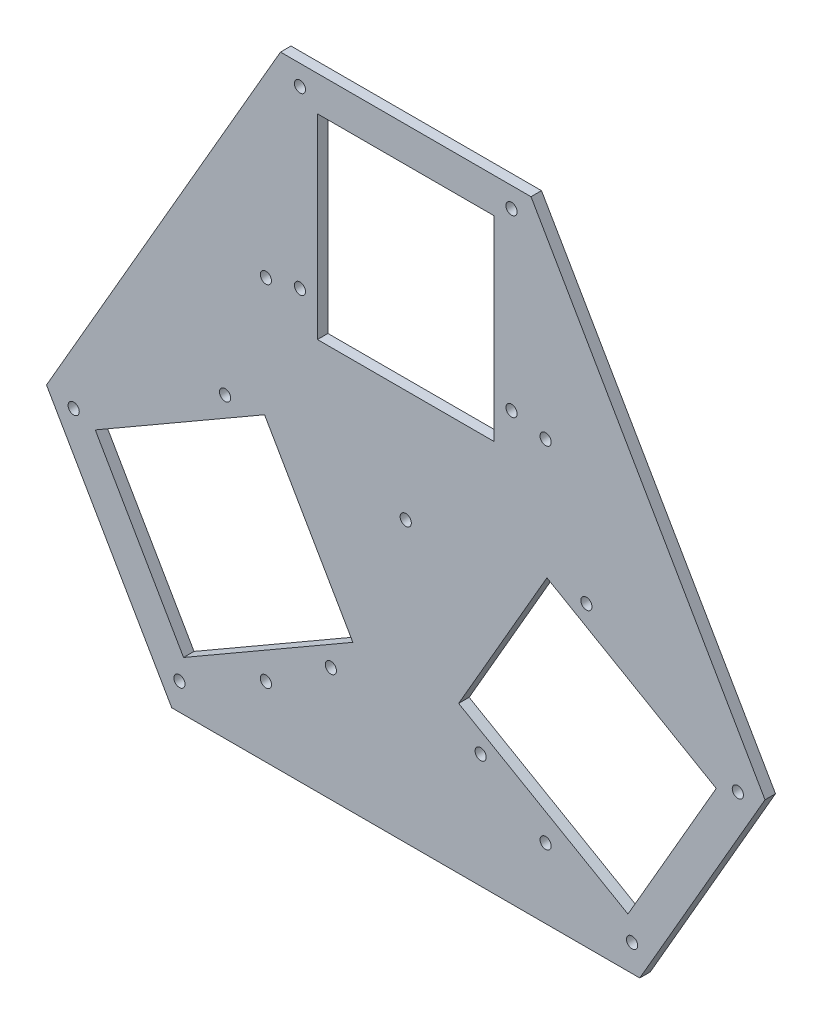
from build123d import *

# Parameters (mm, degrees)
SKETCH_1_R      = 1.6
SKETCH_1_W      = 50.5
SKETCH_1_H      = 55.910884284
EXTRUDE_1_DEPTH = 3


with BuildPart() as part:
    # ｽｹｯﾁ1 → ﾎﾞｽ - 押し出し1 (new body)
    with BuildSketch(Plane.XY):
        Polygon((35.821442181, 97.955442142), (-35.821442181, 97.955442142), (-102.742622424, -17.955442142), (-66.921180243, -80), (66.921180243, -80), (102.742622424, -17.955442142), align=None)
        with Locations((-64.718643518, -72.295017542)):
            Circle(SKETCH_1_R, mode=Mode.SUBTRACT)
        with Locations((-40, -60)):
            Circle(SKETCH_1_R, mode=Mode.SUBTRACT)
        with Locations((-21.417373328, -47.295017542)):
            Circle(SKETCH_1_R, mode=Mode.SUBTRACT)
        with Locations((-94.968643518, -19.900480613)):
            Circle(SKETCH_1_R, mode=Mode.SUBTRACT)
        Polygon((-15.126401158, -37.889420375), (-63.546647296, -65.844862517), (-88.796647296, -22.110579625), (-40.376401158, 5.844862517), align=None, mode=Mode.SUBTRACT)
        with Locations((-51.667373328, 5.099519387)):
            Circle(SKETCH_1_R, mode=Mode.SUBTRACT)
        Circle(SKETCH_1_R, mode=Mode.SUBTRACT)
        with Locations((40, -60)):
            Circle(SKETCH_1_R, mode=Mode.SUBTRACT)
        with Locations((21.417373328, -47.295017542)):
            Circle(SKETCH_1_R, mode=Mode.SUBTRACT)
        with Locations((64.718643518, -72.295017542)):
            Circle(SKETCH_1_R, mode=Mode.SUBTRACT)
        Polygon((40.376401158, 5.844862517), (88.796647296, -22.110579625), (63.546647296, -65.844862517), (15.126401158, -37.889420375), align=None, mode=Mode.SUBTRACT)
        with Locations((94.968643518, -19.900480613)):
            Circle(SKETCH_1_R, mode=Mode.SUBTRACT)
        with Locations((51.667373328, 5.099519387)):
            Circle(SKETCH_1_R, mode=Mode.SUBTRACT)
        with Locations((-40, 40)):
            Circle(SKETCH_1_R, mode=Mode.SUBTRACT)
        with Locations((-30.25, 42.195498156)):
            Circle(SKETCH_1_R, mode=Mode.SUBTRACT)
        with Locations((0, 60)):
            Rectangle(SKETCH_1_W, SKETCH_1_H, mode=Mode.SUBTRACT)
        with Locations((-30.25, 92.195498156)):
            Circle(SKETCH_1_R, mode=Mode.SUBTRACT)
        with Locations((30.25, 42.195498156)):
            Circle(SKETCH_1_R, mode=Mode.SUBTRACT)
        with Locations((40, 40)):
            Circle(SKETCH_1_R, mode=Mode.SUBTRACT)
        with Locations((30.25, 92.195498156)):
            Circle(SKETCH_1_R, mode=Mode.SUBTRACT)
    extrude(amount=EXTRUDE_1_DEPTH)


solid = part.part
